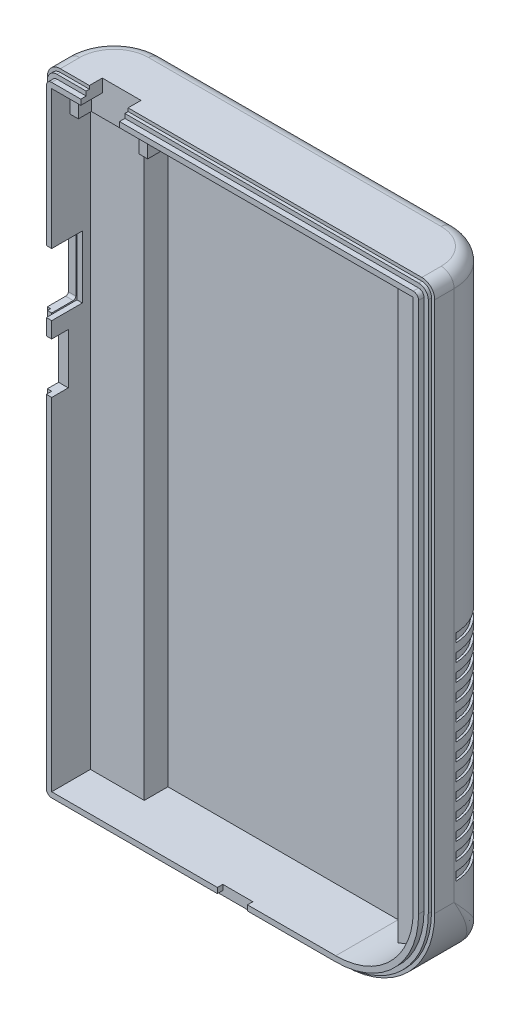
from build123d import *

# Parameters (mm, degrees)
BODY_DEPTH              = 8.75
LOWER_CORNER_CURVE_R    = 21
ROUNDED_BACK_R          = 11
SHELL_T                 = -3
ROUNDED_TOP_BOTTOM_R    = 3
SQUARE_START            = -12
SQUARE_SHELL_CUT_DEPTH  = 12
FRONT_START             = -2
FRONT_EDGE_1_DEPTH      = 2
FRONT_START_2           = -1.25
FRONT_EDGE_2_DEPTH      = 1.25
GRIP_START              = -72.5
GRIP_CUT_DEPTH          = 2
GRIP_PATTERN_COUNT      = 13
GRIP_PATTERN_PITCH      = 4
LEFT_SUPPORT_RIB_REACH  = 88.862
RIB3_REACH              = 88.862
AUDIO_JACK_SLOT_DEPTH   = 1.25
CUT_EXTRUDE10_START     = -3
CUT_EXTRUDE10_DEPTH     = 3
CUT_EXTRUDE11_DEPTH     = 1.25
FILLET9_R               = 0.6
CUT_EXTRUDE12_DEPTH     = 3
CUT_EXTRUDE13_DEPTH     = 0.75
FILLET10_R              = 0.75
POWER_SWITCH_SLOT_REACH = 153.598
BOSS_EXTRUDE4_DEPTH     = 5


# Some blends are built 0.0001 mm under size
with BuildPart() as part:
    # Sketch1 → Body (new, symmetric)
    with BuildSketch(Plane.XY):
        Polygon((-44.99999999999999, 73.75), (45.00000000000001, 73.75), (45.00000000000003, -73.75), (-44.99999999999997, -73.75), align=None)
    extrude(amount=BODY_DEPTH, both=True)

    # Lower Corner Curve
    lower_corner_curve_edges = [part.edges().sort_by_distance(p)[0] for p in [
        (45.00000000000003, -73.75, 0),
    ]]
    fillet(lower_corner_curve_edges, radius=LOWER_CORNER_CURVE_R)

    # Rounded Back
    # the kernel refuses this fillet: 11 mm, written as the material it takes off along each edge
    with BuildSketch(Plane(origin=(45, 101.25, -8.75), x_dir=(0, 0, 1), z_dir=(1.4e-16, -1, 0))) as rounded_back_piece_1:
        with BuildLine():
            CenterArc((ROUNDED_BACK_R, ROUNDED_BACK_R), ROUNDED_BACK_R, 180, 90)
            Line((-1.78e-15, ROUNDED_BACK_R), (0, 0))
            Line((0, 0), (ROUNDED_BACK_R, 0))
        make_face()
    extrude(amount=181.5, mode=Mode.SUBTRACT)
    with BuildSketch(Plane(origin=(-44.999999999999964, -101.25, -8.75), x_dir=(0, 0, 1), z_dir=(-1.4e-16, 1, 0))) as rounded_back_piece_2:
        with BuildLine():
            CenterArc((ROUNDED_BACK_R, ROUNDED_BACK_R), ROUNDED_BACK_R, 180, 90)
            Line((-1.78e-15, ROUNDED_BACK_R), (0, 0))
            Line((0, 0), (ROUNDED_BACK_R, 0))
        make_face()
    extrude(amount=202.5, mode=Mode.SUBTRACT)

    # Shell
    shell_openings = [part.faces().sort_by_distance(p)[0] for p in [
        (-0.289434103, 0.495868746, 8.75),
    ]]
    offset(amount=SHELL_T, openings=shell_openings)

    # Rounded Top/Bottom
    rounded_top_bottom_edges = [part.edges().sort_by_distance(p)[0] for p in [
        (45.00000000000001, 73.75, 5.5),
        (29.158008745388003, -73.10669289895834, -8.75),
        (-44.99999999999999, 73.75, 5.5),
        (41.77817459305202, 73.75, -5.528174593052022),
        (0, 73.75, -8.75),
        (-41.77817459305202, 73.75, -5.528174593052022),
        (-44.99999999999997, -73.75, 5.5),
        (-41.77817459305202, -73.75, -5.528174593052022),
        (-4.999999999999986, -73.75, -8.75),
    ]]
    fillet(rounded_top_bottom_edges, radius=ROUNDED_TOP_BOTTOM_R)

    # Sketch13 → Square Shell Cut (cut)
    with BuildSketch(Plane.XY.offset(8.75).offset(SQUARE_START)):
        with BuildLine():
            Line((-41.999999999999964, -70.75), (23.999999999999993, -70.75))
            ThreePointArc((23.999999999999993, -70.75), (36.72792206135786, -65.47792206135787), (42.00000000000002, -52.75000000000001))
            Line((42.00000000000002, -52.75000000000001), (42, 70.75))
            Line((42, 70.75), (-41.999999999999986, 70.75))
            Line((-41.999999999999986, 70.75), (-41.999999999999964, -70.75))
        make_face()
    extrude(amount=SQUARE_SHELL_CUT_DEPTH, mode=Mode.SUBTRACT)

    # Sketch2 → Front Edge 1 (cut)
    with BuildSketch(Plane.XY.offset(8.75).offset(FRONT_START)):
        with BuildLine():
            Line((-44.99999999999999, 70.75), (-44.99999999999997, -70.75))
            ThreePointArc((-44.99999999999997, -70.75), (-44.12132034355961, -72.87132034355965), (-41.999999999999964, -73.75))
            Line((-41.999999999999964, -73.75), (23.999999999999993, -73.75))
            ThreePointArc((23.999999999999993, -73.75), (38.849242404917504, -67.5992424049175), (45.00000000000002, -52.75000000000001))
            Line((45.00000000000002, -52.75000000000001), (45.00000000000001, 70.75))
            ThreePointArc((45.00000000000001, 70.75), (44.12132034355964, 72.87132034355966), (41.99999999999997, 73.75))
            Line((41.99999999999997, 73.75), (-41.999999999999986, 73.75))
            ThreePointArc((-41.999999999999986, 73.75), (-44.12132034355963, 72.87132034355965), (-44.99999999999999, 70.75))
        make_face()
        with BuildLine():
            Line((-44.24999999999999, 70.75), (-44.24999999999999, -70.75))
            ThreePointArc((-44.24999999999999, -70.75), (-43.590990257669716, -72.34099025766974), (-41.999999999999964, -73))
            Line((-41.999999999999964, -73), (23.999999999999993, -73))
            ThreePointArc((23.999999999999993, -73), (38.31891231902759, -67.0689123190276), (44.25000000000002, -52.750000000000014))
            Line((44.25000000000002, -52.750000000000014), (44.25000000000003, 70.75))
            ThreePointArc((44.25000000000003, 70.75), (43.590990257669745, 72.34099025766976), (41.99999999999998, 73))
            Line((41.99999999999998, 73), (-41.999999999999986, 73))
            ThreePointArc((-41.999999999999986, 73), (-43.590990257669716, 72.34099025766973), (-44.24999999999999, 70.75))
        make_face(mode=Mode.SUBTRACT)
    extrude(amount=FRONT_EDGE_1_DEPTH, mode=Mode.SUBTRACT)

    # Sketch3 → Front Edge 2 (cut)
    with BuildSketch(Plane.XY.offset(8.75).offset(FRONT_START_2)):
        with BuildLine():
            Line((41.99999999999998, 73.00000000000001), (-41.999999999999986, 73))
            ThreePointArc((-41.999999999999986, 73), (-43.590990257669716, 72.34099025766973), (-44.24999999999999, 70.75))
            Line((-44.24999999999999, 70.75), (-44.24999999999999, -70.75))
            ThreePointArc((-44.24999999999999, -70.75), (-43.590990257669716, -72.34099025766974), (-41.999999999999964, -73.00000000000001))
            Line((-41.999999999999964, -73.00000000000001), (23.999999999999993, -73))
            ThreePointArc((23.999999999999993, -73), (38.31891231902759, -67.0689123190276), (44.250000000000014, -52.75000000000001))
            Line((44.250000000000014, -52.75000000000001), (44.25000000000003, 70.75))
            ThreePointArc((44.25000000000003, 70.75), (43.590990257669745, 72.34099025766976), (41.99999999999998, 73.00000000000001))
        make_face()
        with BuildLine():
            Line((41.99999999999997, 72), (-41.999999999999986, 72))
            ThreePointArc((-41.999999999999986, 72), (-42.88388347648317, 71.63388347648319), (-43.24999999999999, 70.75))
            Line((-43.24999999999999, 70.75), (-43.24999999999999, -70.75))
            ThreePointArc((-43.24999999999999, -70.75), (-42.88388347648317, -71.6338834764832), (-41.999999999999964, -72.00000000000001))
            Line((-41.999999999999964, -72.00000000000001), (23.999999999999993, -72.00000000000001))
            ThreePointArc((23.999999999999993, -72.00000000000001), (37.61180553784105, -66.36180553784106), (43.250000000000014, -52.750000000000014))
            Line((43.250000000000014, -52.750000000000014), (43.250000000000014, 70.75))
            ThreePointArc((43.250000000000014, 70.75), (42.883883476483184, 71.6338834764832), (41.99999999999997, 72))
        make_face(mode=Mode.SUBTRACT)
    extrude(amount=FRONT_EDGE_2_DEPTH, mode=Mode.SUBTRACT)

    # Sketch11 → Grip Cut (cut)
    with BuildSketch(Plane(origin=(0, 73.75, 0), x_dir=(1, 0, 0), z_dir=(0, 1, 0)).offset(GRIP_START)):
        with BuildLine():
            Line((-33.99999999999998, 8.75), (34.00000000000001, 8.75))
            ThreePointArc((34.00000000000001, 8.75), (41.599342076785334, 5.702986860293434), (44.98863048791796, -1.7499999999999982))
            Line((44.98863048791796, -1.7499999999999982), (44.488088481701524, -1.7499999999999984))
            ThreePointArc((44.488088481701524, -1.7499999999999984), (41.24568837309473, 5.349342076785337), (34.00000000000001, 8.25))
            Line((34.00000000000001, 8.25), (-33.99999999999998, 8.250000000000002))
            ThreePointArc((-33.99999999999998, 8.250000000000002), (-41.2456883730947, 5.349342076785334), (-44.48808848170151, -1.7499999999999984))
            Line((-44.48808848170151, -1.7499999999999984), (-44.988630487917945, -1.7499999999999984))
            ThreePointArc((-44.988630487917945, -1.7499999999999984), (-41.59934207678531, 5.702986860293436), (-33.99999999999998, 8.75))
        make_face()
    grip_cut = extrude(amount=-GRIP_CUT_DEPTH, mode=Mode.SUBTRACT)

    # Grip Pattern: Grip Cut ×13
    with Locations(*[(0, -i * GRIP_PATTERN_PITCH, 0) for i in range(1, GRIP_PATTERN_COUNT)]):
        add(grip_cut, mode=Mode.SUBTRACT)

    # Sketch12 walls → Left Support Rib (add, up to next)
    with BuildSketch(Plane.XY.offset(-0.2500000000000011), mode=Mode.PRIVATE) as left_support_rib_sk1:
        Polygon((-42, 128.24696486712998), (-41.99999999999998, -74.61900272231082), (-29.49999999999998, -74.61900272231082), (-29.500000000000004, 128.24696486712998), align=None)
    left_support_rib_tool1 = extrude(left_support_rib_sk1.sketch, amount=-LEFT_SUPPORT_RIB_REACH, mode=Mode.PRIVATE) - part.part
    add(left_support_rib_tool1.solids().sort_by_distance((-29.5, 26.813981072, -0.25))[0])

    # Sketch14 walls → Rib3 (add, up to next)
    with BuildSketch(Plane.XY.offset(-0.2500000000000011), mode=Mode.PRIVATE) as rib3_sk1:
        Polygon((29.500000000000014, 119.2884076138571), (29.500000000000032, -95.43888778670488), (42.00000000000003, -95.43888778670488), (42.000000000000014, 119.2884076138571), align=None)
    rib3_tool1 = extrude(rib3_sk1.sketch, amount=-RIB3_REACH, mode=Mode.PRIVATE) - part.part
    add(rib3_tool1.solids().sort_by_distance((29.5, 11.924759914, -0.25))[0])

    # Sketch15 → Audio Jack slot (cut)
    with BuildSketch(Plane.XY.offset(8.75)):
        Polygon((-3.500000000000003, -72.00000000000001), (-3.5, -70.75), (3.5, -70.75), (3.500000000000003, -72.00000000000001), align=None)
    extrude(amount=-AUDIO_JACK_SLOT_DEPTH, mode=Mode.SUBTRACT)

    # Sketch16 → Cut-Extrude10 (cut)
    with BuildSketch(Plane.ZY.offset(44.99999999999998).offset(CUT_EXTRUDE10_START)):
        Polygon((8.750000000000004, 38.24999999999999), (8.750000000000007, 24.34999999999999), (1.9000000000000068, 24.34999999999999), (1.900000000000005, 38.24999999999999), align=None)
    extrude(amount=CUT_EXTRUDE10_DEPTH, mode=Mode.SUBTRACT)

    # Sketch17 → Cut-Extrude11 (cut)
    with BuildSketch(Plane(origin=(-41.99999999999997, -5.93e-15, 0), x_dir=(0, 0, -1), z_dir=(1, 1.4e-16, 0))):
        Polygon((-8.75, 38.55), (-1.6300000000000003, 38.55), (-1.6299999999999986, 24.049999999999994), (-8.749999999999998, 24.049999999999994), align=None)
    extrude(amount=-CUT_EXTRUDE11_DEPTH, mode=Mode.SUBTRACT)

    # Fillet9
    fillet9_edges = [part.edges().sort_by_distance(p)[0] for p in [
        (-44.12221520408288, 24.349999999999984, 1.9000000000000068),
        (-44.12221520408286, 38.249999999999986, 1.900000000000005),
    ]]
    fillet(fillet9_edges, radius=FILLET9_R)

    # Sketch18 → Cut-Extrude12 (cut)
    with BuildSketch(Plane.ZY.offset(44.99999999999998)):
        Polygon((4.9, 20.34999999999999), (8.749999999999998, 20.34999999999999), (8.749999999999998, 8.599999999999989), (4.900000000000002, 8.599999999999989), align=None)
    extrude(amount=-CUT_EXTRUDE12_DEPTH, mode=Mode.SUBTRACT)

    # Sketch19 → Cut-Extrude13 (cut)
    with BuildSketch(Plane.ZY.offset(44.99999999999998)):
        Polygon((6.750000000000001, 22.349999999999987), (-8.75, 22.349999999999984), (-8.75, 6.599999999999988), (6.750000000000003, 6.599999999999988), align=None)
    extrude(amount=-CUT_EXTRUDE13_DEPTH, mode=Mode.SUBTRACT)

    # Fillet10
    fillet10_edges = [part.edges().sort_by_distance(p)[0] for p in [
        (-44.81087415521982, 6.599999999999994, 0.2189903988409796),
        (-44.81087415521982, 22.349999999999994, 0.2189903988409796),
        (-44.99999999999998, 6.599999999999982, 4.500000000000002),
        (-44.99999999999998, 22.34999999999998, 4.5),
    ]]
    fillet(fillet10_edges, radius=FILLET10_R - 0.0001)  # a hair under: the kernel refuses the full size

    # Power Switch Slot: up to this face of the body (flat: up to its plane)
    power_switch_slot_end = Plane(part.part.faces().sort_by_distance((0, 73.75, 0.619894516))[0])
    # Sketch21 → Power Switch Slot (cut, up to the picked face)
    with BuildSketch(Plane.XZ.offset(-70.75), mode=Mode.PRIVATE) as power_switch_slot_sk1:
        Polygon((-35.249999999999986, 8.75), (-26.249999999999982, 8.75), (-26.249999999999982, 3.750000000000001), (-35.24999999999999, 3.750000000000001), align=None)
    power_switch_slot_tool1 = split(extrude(power_switch_slot_sk1.sketch, amount=-POWER_SWITCH_SLOT_REACH, mode=Mode.PRIVATE), bisect_by=power_switch_slot_end, keep=Keep.BOTH, mode=Mode.PRIVATE)
    add(power_switch_slot_tool1.solids().sort_by(Axis((-30.75, 70.75, 6.25), (0, 1, 0)))[0], mode=Mode.SUBTRACT)

    # Sketch22 → Boss-Extrude4 (add)
    with BuildSketch(Plane.XZ.offset(-70.75)):
        Polygon((-21.69999999999998, -5.750000000000002), (-21.69999999999998, 6.749999999999999), (-23.699999999999985, 6.749999999999999), (-23.699999999999985, 3.749999999999999), (-37.79999999999998, 3.749999999999999), (-37.79999999999998, 6.749999999999999), (-39.79999999999999, 6.749999999999999), (-39.79999999999999, -0.2500000000000002), (-29.499999999999996, -0.2500000000000002), (-29.499999999999996, -5.750000000000002), align=None)
    extrude(amount=BOSS_EXTRUDE4_DEPTH)


solid = part.part
